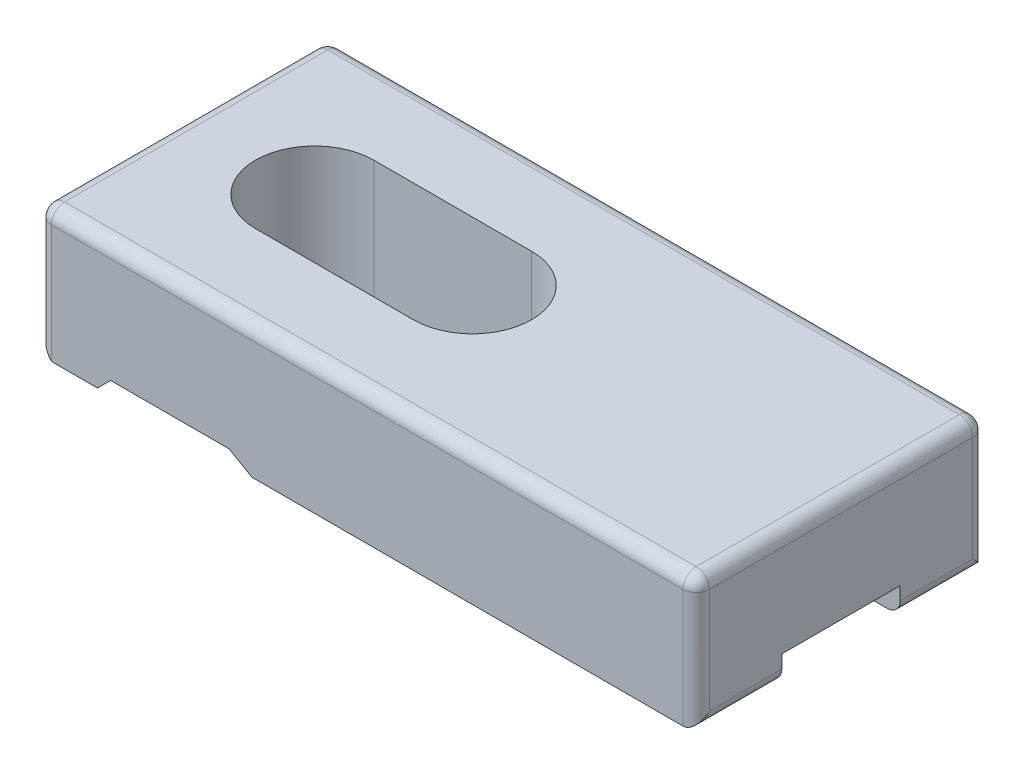
from build123d import *
from OCP.BRepFilletAPI import BRepFilletAPI_MakeChamfer

# Parameters (mm, degrees)
SKETCH_1_W          = 50
SKETCH_1_H          = 22
EXTRUDE_1_DEPTH     = 10
CUT_EXTRUDE_1_DEPTH = 2
CUT_EXTRUDE_2_DEPTH = 1
CHAMFER_1_SIZE      = 1
CHAMFER_2_SIZE      = 1
CHAMFER_2_SIZE_2    = 1.732050808
FILLET_1_R          = 1


with BuildPart() as part:
    # 草图1 → 凸台-拉伸1 (new body)
    with BuildSketch(Plane(origin=(0, 0, 0), x_dir=(1, 0, 0), z_dir=(0, 1, 0))):
        with Locations((25, 11)):
            Rectangle(SKETCH_1_W, SKETCH_1_H)
        with BuildLine():
            Line((22, 6.5), (10, 6.5))
            ThreePointArc((10, 6.5), (5.5, 11), (10, 15.5))
            Line((10, 15.5), (22, 15.5))
            ThreePointArc((22, 15.5), (26.5, 11), (22, 6.5))
        make_face(mode=Mode.SUBTRACT)
    extrude(amount=EXTRUDE_1_DEPTH)

    # 草图2 → 切除-拉伸1 (cut)
    with BuildSketch(Plane.XZ):
        with BuildLine():
            Line((50, -6.5), (50, -15.5))
            Line((50, -15.5), (10, -15.5))
            ThreePointArc((10, -15.5), (5.5, -11), (10, -6.5))
            Line((10, -6.5), (50, -6.5))
        make_face()
    extrude(amount=-CUT_EXTRUDE_1_DEPTH, mode=Mode.SUBTRACT)

    # 草图3 → 切除-拉伸2 (cut)
    with BuildSketch(Plane.XZ):
        Polygon((0, -6.5), (5.5, -6.5), (5.5, 0), (14.5, 0), (14.5, -22), (5.5, -22), (5.5, -15.5), (0, -15.5), align=None)
    extrude(amount=-CUT_EXTRUDE_2_DEPTH, mode=Mode.SUBTRACT)

    # 倒角1
    chamfer_1_edges = [part.edges().sort_by_distance(p)[0] for p in [
        (0, 0, -18.75),
        (5.5, 0, -18.75),
        (5.5, 0, -3.25),
        (0, 0, -3.25),
    ]]
    chamfer(chamfer_1_edges, length=CHAMFER_1_SIZE - 0.0001)  # a hair under: the kernel refuses the full size

    # 倒角2
    chamfer_2_edges_1 = [part.edges().sort_by_distance(p)[0] for p in [
        (14.5, 0, -18.75),
    ]]
    chamfer_2_side_1 = [part.faces().sort_by_distance(p)[0] for p in [
        (14.5, 0.02, -18.75),
    ]]
    chamfer_2_edges_2 = [part.edges().sort_by_distance(p)[0] for p in [
        (14.5, 0, -3.25),
    ]]
    chamfer_2_side_2 = [part.faces().sort_by_distance(p)[0] for p in [
        (14.5, 0.02, -3.25),
    ]]
    chamfer_2 = BRepFilletAPI_MakeChamfer(part.part.solid().wrapped)
    for e in chamfer_2_edges_1:
        chamfer_2.Add(CHAMFER_2_SIZE - 0.0001, CHAMFER_2_SIZE_2 - 0.0001, e.wrapped, chamfer_2_side_1[0].wrapped)
    for e in chamfer_2_edges_2:
        chamfer_2.Add(CHAMFER_2_SIZE - 0.0001, CHAMFER_2_SIZE_2 - 0.0001, e.wrapped, chamfer_2_side_2[0].wrapped)
    add(Compound.cast(chamfer_2.Shape()), mode=Mode.REPLACE)  # a hair under: the kernel refuses the full size

    # 圆角1
    fillet_1_edges = [part.edges().sort_by_distance(p)[0] for p in [
        (25, 10, -22),
        (50, 10, -11),
        (25, 10, 0),
        (0, 10, -11),
        (50, 5, 0),
        (50, 5, -22),
        (0, 5.49995, -22),
        (0, 5.49995, 0),
        (50, 0, -18.75),
        (50, 0, -3.25),
    ]]
    fillet(fillet_1_edges, radius=FILLET_1_R)


solid = part.part
